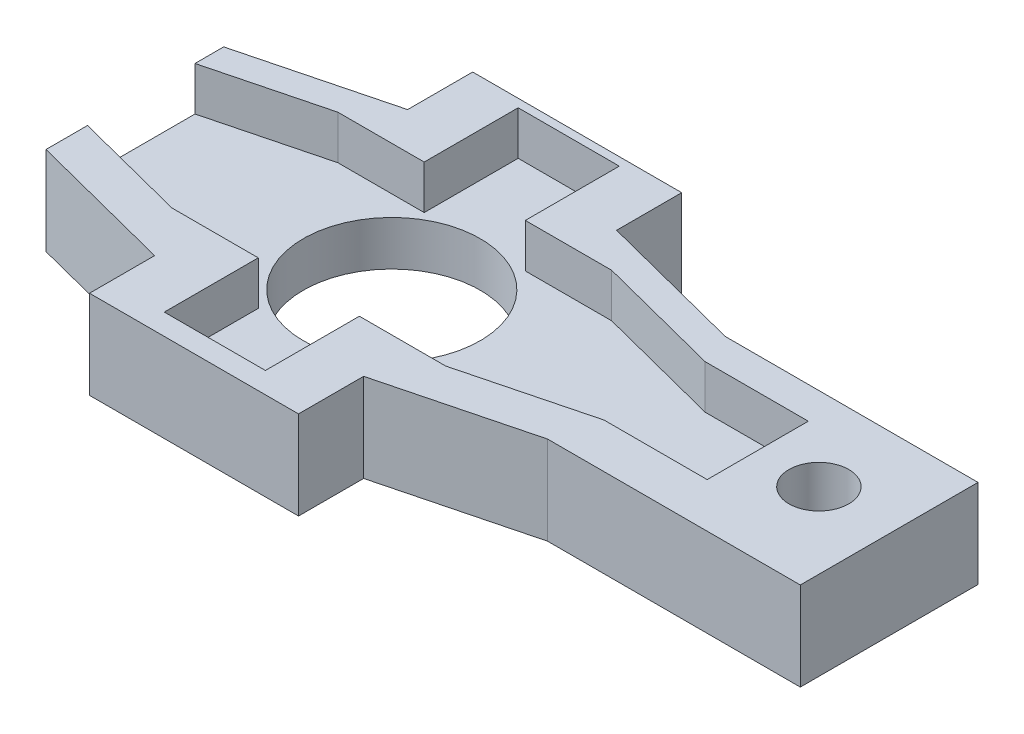
from build123d import *

# Parameters (mm, degrees)
SKETCH1_R           = 1.5
BOSS_EXTRUDE1_DEPTH = 4.445
CUT_EXTRUDE1_DEPTH  = 2.19964
SKETCH2_3_R         = 4.445
CUT_EXTRUDE2_DEPTH  = 19.97964


with BuildPart() as part:
    # Sketch1 → Boss-Extrude1 (new body)
    with BuildSketch(Plane(origin=(0, 0, 0), x_dir=(1, 0, 0), z_dir=(0, 1, 0))):
        Polygon((-12.598868717, 4.18434255), (-12.598868717, -4.742883604), (-5.250501517, -6.634352539), (-5.250501517, -9.905189975), (5.250501517, -9.905189975), (5.250501517, -6.634352539), (12.598868717, -4.742883604), (25.298868717, -4.742883604), (25.298868717, 4.18434255), (12.598868717, 4.18434255), (5.250501517, 6.075811486), (5.250501517, 9.346648922), (-5.250501517, 9.346648922), (-5.250501517, 6.075811486), align=None)
        with Locations((21.488868717, 0)):
            Circle(SKETCH1_R, mode=Mode.SUBTRACT)
    extrude(amount=BOSS_EXTRUDE1_DEPTH)

    # Sketch2 → Cut-Extrude1 (cut)
    with BuildSketch(Plane(origin=(0, 4.445, 0), x_dir=(1, 0, 0), z_dir=(0, 1, 0))):
        Polygon((-12.598868717, 2.741650882), (-12.598868717, -2.656110272), (-6.88983602, -4.125614681), (-2.551509285, -4.125614681), (-2.551509285, -8.847229695), (2.528490715, -8.847229695), (2.528490715, -4.125614681), (6.866817451, -4.125614681), (13.193102062, -2.497229695), (18.374272711, -2.497229695), (18.374272711, 2.582770305), (13.193102062, 2.582770305), (6.866817451, 4.211155292), (2.528490715, 4.211155292), (2.528490715, 8.932770305), (-2.551509285, 8.932770305), (-2.551509285, 4.211155292), (-6.88983602, 4.211155292), align=None)
    extrude(amount=-CUT_EXTRUDE1_DEPTH, mode=Mode.SUBTRACT)

    # Sketch2<3> → Cut-Extrude2 (cut)
    with BuildSketch(Plane(origin=(0, 4.445, 0), x_dir=(1, 0, 0), z_dir=(0, 1, 0))):
        with Locations((-0.011509285, 0.042770305)):
            Circle(SKETCH2_3_R)
    extrude(amount=-CUT_EXTRUDE2_DEPTH, mode=Mode.SUBTRACT)


solid = part.part
